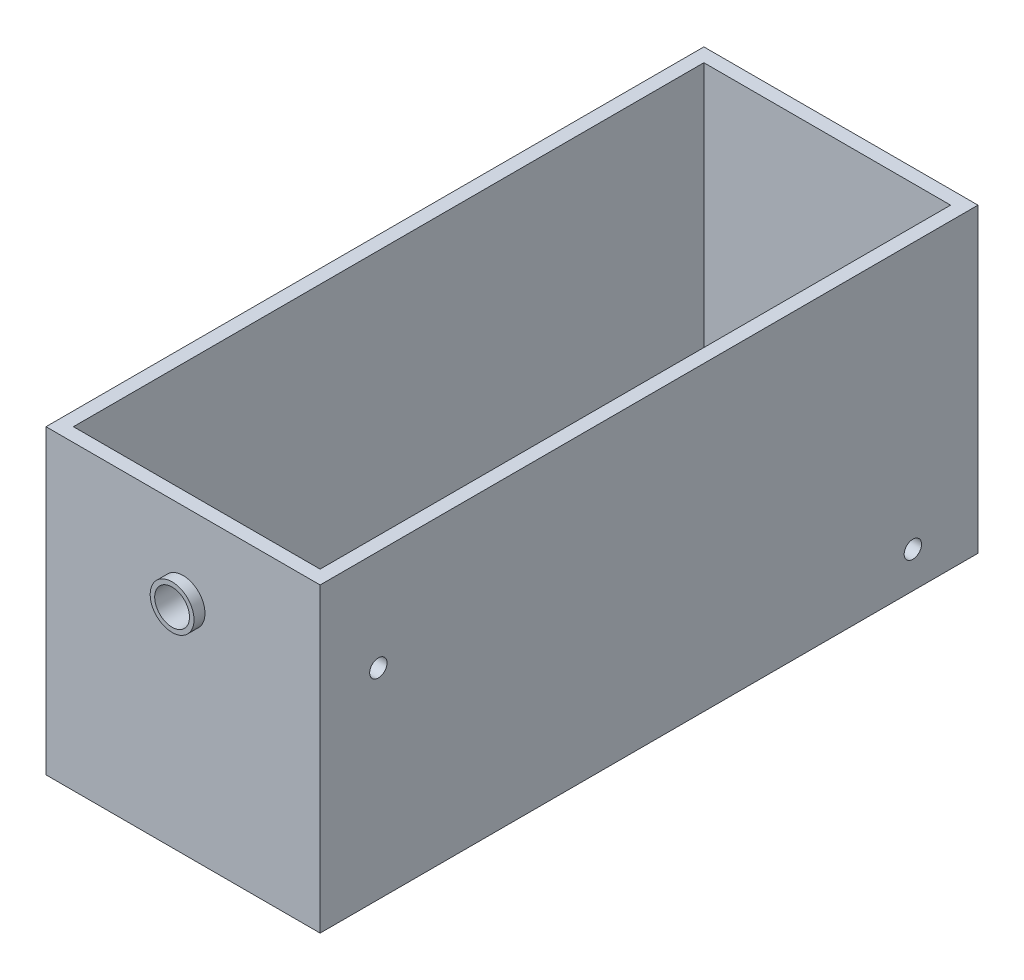
from build123d import *

# Parameters (mm, degrees)
SKETCH1_W           = 50
SKETCH1_H           = 120
BOSS_EXTRUDE1_DEPTH = 5
SKETCH2_W           = 50
SKETCH2_H           = 120
SKETCH2_W_2         = 45
SKETCH2_H_2         = 115
BOSS_EXTRUDE2_DEPTH = 50
SKETCH3_R           = 3.175
CUT_EXTRUDE1_DEPTH  = 50
BOSS_EXTRUDE3_START = 2
SKETCH4_R           = 4
SKETCH4_R_2         = 3.175
BOSS_EXTRUDE3_DEPTH = 2
SKETCH5_R           = 3.175
CUT_EXTRUDE2_DEPTH  = 14
BOSS_EXTRUDE4_START = 2
SKETCH6_R           = 4
SKETCH6_R_2         = 3.175
BOSS_EXTRUDE4_DEPTH = 2
SKETCH7_R           = 1.5875
SKETCH7_R_2         = 1.584953317
CUT_EXTRUDE3_DEPTH  = 10


with BuildPart() as part:
    # Sketch1 → Boss-Extrude1 (new body)
    with BuildSketch(Plane(origin=(0, 0, 0), x_dir=(1, 0, 0), z_dir=(0, 1, 0))):
        Rectangle(SKETCH1_W, SKETCH1_H)
    extrude(amount=BOSS_EXTRUDE1_DEPTH)

    # Sketch2 → Boss-Extrude2 (add)
    with BuildSketch(Plane(origin=(0, 5, 0), x_dir=(1, 0, 0), z_dir=(0, 1, 0))):
        Rectangle(SKETCH2_W, SKETCH2_H)
        Rectangle(SKETCH2_W_2, SKETCH2_H_2, mode=Mode.SUBTRACT)
    extrude(amount=BOSS_EXTRUDE2_DEPTH)

    # Sketch3 → Cut-Extrude1 (cut)
    with BuildSketch(Plane.XY.offset(60)):
        with Locations((0, 40)):
            Circle(SKETCH3_R)
    extrude(amount=-CUT_EXTRUDE1_DEPTH, mode=Mode.SUBTRACT)

    # Sketch4 → Boss-Extrude3 (add)
    with BuildSketch(Plane.XY.offset(60).offset(BOSS_EXTRUDE3_START)):
        with Locations((0, 40)):
            Circle(SKETCH4_R)
        with Locations((0, 40)):
            Circle(SKETCH4_R_2, mode=Mode.SUBTRACT)
    extrude(amount=-BOSS_EXTRUDE3_DEPTH)

    # Sketch5 → Cut-Extrude2 (cut)
    with BuildSketch(Plane(origin=(0, 0, -60), x_dir=(-1, 0, 0), z_dir=(0, 0, -1))):
        with Locations((0, 10)):
            Circle(SKETCH5_R)
    extrude(amount=-CUT_EXTRUDE2_DEPTH, mode=Mode.SUBTRACT)

    # Sketch6 → Boss-Extrude4 (add)
    with BuildSketch(Plane(origin=(0, 0, -60), x_dir=(-1, 0, 0), z_dir=(0, 0, -1)).offset(BOSS_EXTRUDE4_START)):
        with Locations((0, 10)):
            Circle(SKETCH6_R)
        with Locations((0, 10)):
            Circle(SKETCH6_R_2, mode=Mode.SUBTRACT)
    extrude(amount=-BOSS_EXTRUDE4_DEPTH)

    # Sketch7 → Cut-Extrude3 (cut)
    with BuildSketch(Plane(origin=(25, 0, 0), x_dir=(0, 0, -1), z_dir=(1, 0, 0))):
        with Locations((-49.376753438, 36.584944591)):
            Circle(SKETCH7_R)
        with Locations((48.120699894, 6.584953317)):
            Circle(SKETCH7_R_2)
    extrude(amount=-CUT_EXTRUDE3_DEPTH, mode=Mode.SUBTRACT)


solid = part.part
